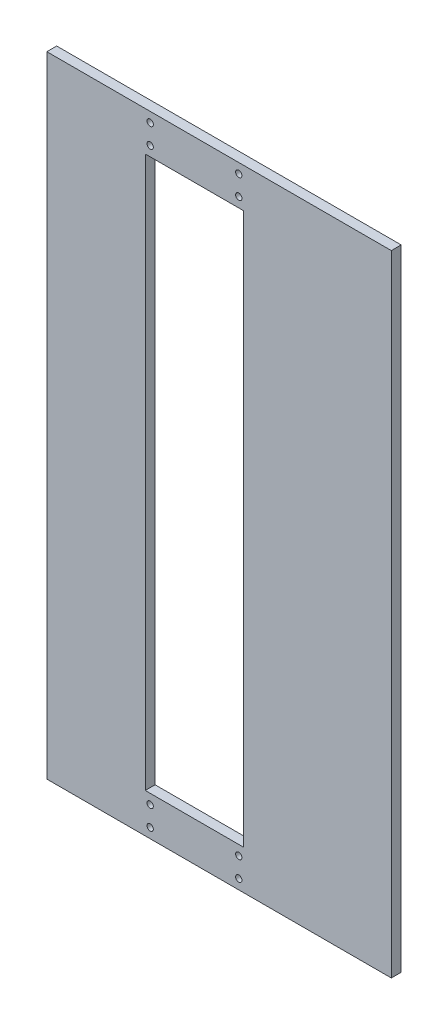
from build123d import *

# Parameters (mm, degrees)
SKETCH1_W           = 100
SKETCH1_H           = 320
SKETCH1_R           = 1.6
SKETCH1_W_2         = 50
SKETCH1_H_2         = 280
BOSS_EXTRUDE1_DEPTH = 5
SKETCH2_W           = 50
SKETCH2_H           = 320
BOSS_EXTRUDE2_DEPTH = 5
SKETCH3_W           = 25
SKETCH3_H           = 320
BOSS_EXTRUDE3_DEPTH = 5


with BuildPart() as part:
    # Sketch1 → Boss-Extrude1 (new body)
    with BuildSketch(Plane.XY):
        Rectangle(SKETCH1_W, SKETCH1_H)
        with Locations((-22.5, 145)):
            Circle(SKETCH1_R, mode=Mode.SUBTRACT)
        with Locations((-22.5, 155)):
            Circle(SKETCH1_R, mode=Mode.SUBTRACT)
        with Locations((22.5, 145)):
            Circle(SKETCH1_R, mode=Mode.SUBTRACT)
        with Locations((22.5, -145)):
            Circle(SKETCH1_R, mode=Mode.SUBTRACT)
        with Locations((-22.5, -145)):
            Circle(SKETCH1_R, mode=Mode.SUBTRACT)
        with Locations((22.5, 155)):
            Circle(SKETCH1_R, mode=Mode.SUBTRACT)
        with Locations((22.5, -155)):
            Circle(SKETCH1_R, mode=Mode.SUBTRACT)
        with Locations((-22.5, -155)):
            Circle(SKETCH1_R, mode=Mode.SUBTRACT)
        Rectangle(SKETCH1_W_2, SKETCH1_H_2, mode=Mode.SUBTRACT)
    extrude(amount=BOSS_EXTRUDE1_DEPTH)

    # Sketch2 → Boss-Extrude2 (add)
    with BuildSketch(Plane.XY):
        with Locations((75, 0)):
            Rectangle(SKETCH2_W, SKETCH2_H)
    extrude(amount=BOSS_EXTRUDE2_DEPTH)

    # Sketch3 → Boss-Extrude3 (add)
    with BuildSketch(Plane.XY):
        with Locations((-62.5, 0)):
            Rectangle(SKETCH3_W, SKETCH3_H)
    extrude(amount=BOSS_EXTRUDE3_DEPTH)


solid = part.part
